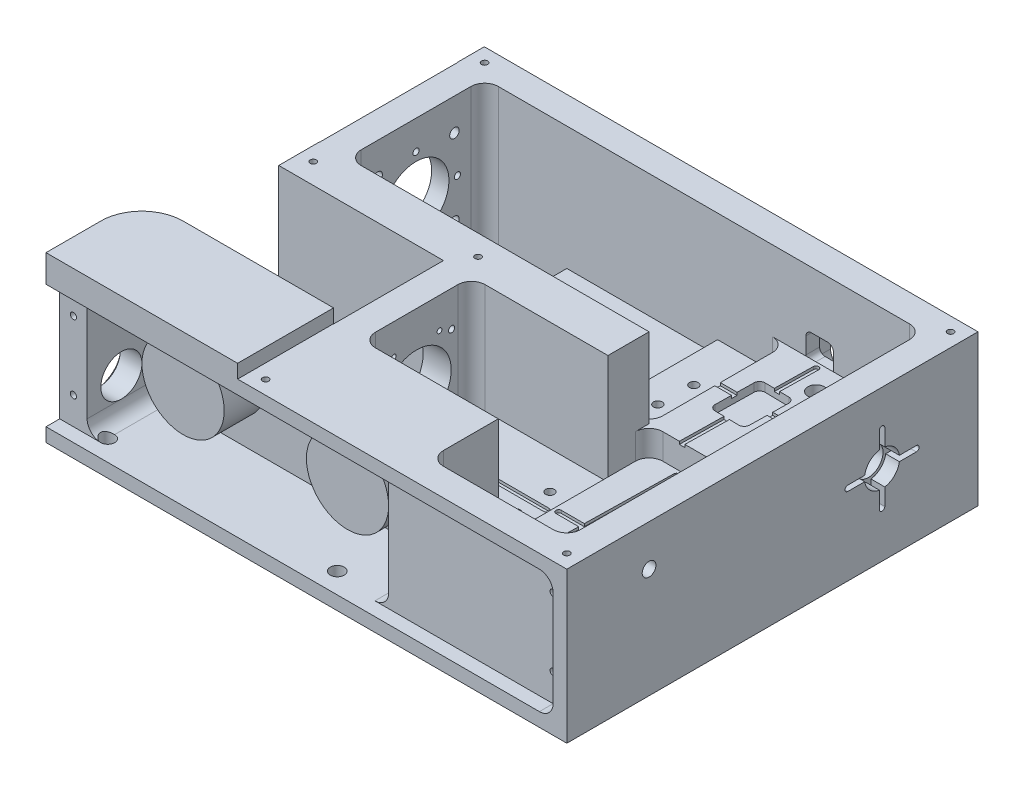
from build123d import *

# Parameters (mm, degrees)
SKETCH7_W                                  = 190
SKETCH7_H                                  = 150
BOSS_EXTRUDE2_DEPTH                        = 60
DIODE_RECESS_REACH                         = 260.362
SKETCH8_W                                  = 10
SKETCH8_H                                  = 50
SKETCH9_W                                  = 30
SKETCH9_H                                  = 50
COLLIMATION_SPACE_DEPTH                    = 55
WAVEPLATE_W                                = 25
WAVEPLATE_H                                = 50
WAVEPLATE_R                                = 1.6
WAVEPLATE_SEAT_DEPTH                       = 45
WAVEPLATE_4_R                              = 1.6
WAVEPLATE_HOLES_DEPTH                      = 49.8
PBS_PIEZO_MIRROR_CORNER_W                  = 25
PBS_PIEZO_MIRROR_CORNER_H                  = 50
PBS_MOUNT_DEPTH                            = 34.05
EXITWINDOW_W                               = 25
EXITWINDOW_H                               = 50
EXIT_WINDOW_DEPTH                          = 34.05
WAVEPLATES_W                               = 49.778354438
WAVEPLATES_H                               = 40
WAVEPLATES_R                               = 1.6
WAVEPLATE_SEAT_2_DEPTH                     = 45
WAVEPLATES_3_R                             = 1.6
WAVEPLATE_HOLES_2_DEPTH                    = 49.8
FIBERPORT_REACH                            = 260.362
FIBERDOCK_W                                = 70
FIBERDOCK_H                                = 40
DIODE_THRU_HOLES_REACH                     = 212.614
SKETCH20_R                                 = 9.9
FIBERPORT_MOUNTING_HOLE_REACH              = 164.352
FIBERPORT_HOLE_R                           = 12.6
EXIT_WINDOW_THRU_HOLE_REACH                = 212.614
SKETCH24_R                                 = 5.35
FILLET7_R                                  = 5
FILLET8_R                                  = 5
PBS_SEAT_DEPTH                             = 37.05
PBS_PIEZO_MIRROR_CORNER_9_W                = 50
PBS_PIEZO_MIRROR_CORNER_9_H                = 80
MIRROR_MOUNT_DEPTH                         = 43.4
FILLET11_R                                 = 2
FILLET12_R                                 = 5
TELESCOPE_W                                = 25
TELESCOPE_H                                = 50
TELESCOPE_INSERT_DEPTH                     = 50
EXIT_START                                 = -5
EXIT_WINDOW_SEAT_DEPTH                     = 5
CUT_EXTRUDE59_REACH                        = 212.614
CUT_EXTRUDE60_DEPTH                        = 211.613972108
CUT_EXTRUDE60_DEPTH_BACK                   = 3.7
SKETCH20_6_R                               = 22.5
APERTURE_W                                 = 30
APERTURE_H                                 = 50
APERTURE_W_2                               = 15
CUT_EXTRUDE61_DEPTH                        = 50
NORMAL_8_SCREW_SLOT_REACH                  = 260.362
F_8_HEX_NUT_RECESS_DEPTH                   = 10
FIBER_BED_DEPTH                            = 30
SKETCH28_10_R                              = 15
FIBER_SPOOLS_DEPTH                         = 15
FILLET16_R                                 = 5
ALIGNMENT_GROOVE1_DEPTH                    = 1
ALIGNMENT_GROOVE2_DEPTH                    = 1
ALIGNMENT_GROOVE3_DEPTH                    = 1
ALIGNMENT_GROOVE5_DEPTH                    = 1
PHOTODIODE_WINDOW_DEPTH                    = 10
PHOTODIODE_RECESS_DEPTH                    = 5
PIEZO_WIRE_EXIT_HOLE_REACH                 = 221.222
SKETCH46_R                                 = 2.5
ALIGNMENT_GROOVE4_DEPTH                    = 1
F_1_4_20_TAPPED_HOLE1_D                    = 5.1054
F_1_4_20_TAPPED_HOLE1_DEPTH                = 9.5
F_1_4_20_TAPPED_HOLE1_TIP                  = 1.533816902
SKETCH47_W                                 = 54
SKETCH47_H                                 = 51
TEC_GROOVES_DEPTH                          = 1
FILLET17_R                                 = 2
FILLET18_R                                 = 15
SKETCH50_W                                 = 185
SKETCH50_H                                 = 45
CUT_EXTRUDE72_DEPTH                        = 5
FILLET19_R                                 = 5
F_4_40_TAPPED_HOLE1_D                      = 2.2606
F_4_40_TAPPED_HOLE1_DEPTH                  = 7.6
F_4_40_TAPPED_HOLE1_TIP                    = 0.679152758
F_6_32_TAPPED_HOLE1_D                      = 2.7051
F_6_32_TAPPED_HOLE3_D                      = 2.7051
SKETCH64_R                                 = 3
CUT_EXTRUDE73_DEPTH                        = 7
CUT_EXTRUDE74_DEPTH                        = 5
F_4_40_TAPPED_HOLE2_D                      = 2.2606
F_4_40_TAPPED_HOLE2_DEPTH                  = 7.6
F_4_40_TAPPED_HOLE2_TIP                    = 0.679152758
CUT_EXTRUDE75_REACH                        = 260.362
SKETCH76_W                                 = 9.9
SKETCH76_H                                 = 10
SKETCH76_H_2                               = 15
SKETCH77_R                                 = 4
SKETCH77_R_2                               = 1.5
CUT_EXTRUDE76_DEPTH                        = 5
F_8_32_TAPPED_HOLE1_REACH                  = 212.614
F_8_32_TAPPED_HOLE1_BORE_R                 = 1.7272
F_2_56_START                               = 114.078066781
F_2_56_TAPPED_HOLE1_OUTLINE_R              = 0.889
F_2_56_TAPPED_HOLE1_DEPTH                  = 10.221645562
F_4_40_TAPPED_HOLE4_REACH                  = 209.461
F_4_40_TAPPED_HOLE4_BORE_R                 = 1.1303
F_6_32_TAPPED_HOLE4_D                      = 2.7051
CSK_FIBERBED_THRU_HOLE_D                   = 14.999999972
CSK_FIBERBED_THRU_HOLE_DEPTH               = 10
CSK_FIBERBED_THRU_HOLE_CSINK_D             = 19.999999878
CSK_FIBERBED_THRU_HOLE_CSINK_ANGLE         = 100
SUK_ADAPTER_FLANGE_2_56_TAPPED_HOLES_D     = 2.2606
SUK_ADAPTER_FLANGE_2_56_TAPPED_HOLES_DEPTH = 10.221645562


# Read off the part's stored shape, not the designer's step: #2-56 Tapped Hole1
with BuildPart() as part:
    # Sketch7 → Boss-Extrude2 (new body)
    with BuildSketch(Plane(origin=(0, 0, 0), x_dir=(1, 0, 0), z_dir=(0, 1, 0))):
        with Locations((139.078066781, -16.423439265)):
            Rectangle(SKETCH7_W, SKETCH7_H)
    extrude(amount=BOSS_EXTRUDE2_DEPTH)

    # Sketch8 → diode_recess (cut, up to next)
    with BuildSketch(Plane(origin=(0, 60, 0), x_dir=(1, 0, 0), z_dir=(0, 1, 0)), mode=Mode.PRIVATE) as diode_recess_sk1:
        with Locations((49.078066781, 23.576560735)):
            Rectangle(SKETCH8_W, SKETCH8_H)
    diode_recess_tool1 = extrude(diode_recess_sk1.sketch, amount=-DIODE_RECESS_REACH, mode=Mode.PRIVATE) & part.part
    add(diode_recess_tool1.solids().sort_by_distance((49.078067, 60, -23.576561))[0], mode=Mode.SUBTRACT)

    # Sketch9 → collimation space (cut)
    with BuildSketch(Plane(origin=(0, 60, 0), x_dir=(1, 0, 0), z_dir=(0, 1, 0))):
        with Locations((79.078066781, 23.576560735)):
            Rectangle(SKETCH9_W, SKETCH9_H)
    extrude(amount=-COLLIMATION_SPACE_DEPTH, mode=Mode.SUBTRACT)

    # waveplate → waveplate seat (cut)
    with BuildSketch(Plane(origin=(0, 60, 0), x_dir=(1, 0, 0), z_dir=(0, 1, 0))):
        with Locations((161.578066781, 23.576560735)):
            Rectangle(WAVEPLATE_W, WAVEPLATE_H)
        with Locations(Location((159.078066781, 29.922692486, 0), (0, 0, 270))):
            Circle(WAVEPLATE_R, mode=Mode.SUBTRACT)
        with Locations(Location((158.634843173, 17.230428983, 0), (0, 0, 270))):
            Circle(WAVEPLATE_R, mode=Mode.SUBTRACT)
    extrude(amount=-WAVEPLATE_SEAT_DEPTH, mode=Mode.SUBTRACT)

    # waveplate<4> → waveplate holes (cut)
    with BuildSketch(Plane(origin=(0, 60, 0), x_dir=(1, 0, 0), z_dir=(0, 1, 0))):
        with Locations(Location((159.078066781, 29.922692486, 0), (0, 0, 270))):
            Circle(WAVEPLATE_4_R)
        with Locations(Location((158.634843173, 17.230428983, 0), (0, 0, 270))):
            Circle(WAVEPLATE_4_R)
    extrude(amount=-WAVEPLATE_HOLES_DEPTH, mode=Mode.SUBTRACT)

    # PBS + piezo mirror corner → PBS mount (cut)
    with BuildSketch(Plane(origin=(0, 60, 0), x_dir=(1, 0, 0), z_dir=(0, 1, 0))):
        with Locations((186.578066781, 23.576560735)):
            Rectangle(PBS_PIEZO_MIRROR_CORNER_W, PBS_PIEZO_MIRROR_CORNER_H)
    extrude(amount=-PBS_MOUNT_DEPTH, mode=Mode.SUBTRACT)

    # exitwindow → exit_window (cut)
    with BuildSketch(Plane(origin=(0, 60, 0), x_dir=(1, 0, 0), z_dir=(0, 1, 0))):
        with Locations((211.578066781, 23.576560735)):
            Rectangle(EXITWINDOW_W, EXITWINDOW_H)
    extrude(amount=-EXIT_WINDOW_DEPTH, mode=Mode.SUBTRACT)

    # waveplates → waveplate seat 2 (cut)
    with BuildSketch(Plane(origin=(0, 60, 0), x_dir=(1, 0, 0), z_dir=(0, 1, 0))):
        with Locations((149.188889562, -36.423439265)):
            Rectangle(WAVEPLATES_W, WAVEPLATES_H)
        with Locations(Location((166.578066781, -30.074406401, 0), (0, 0, 270))):
            Circle(WAVEPLATES_R, mode=Mode.SUBTRACT)
        with Locations(Location((166.799712343, -42.77247213, 0), (0, 0, 270))):
            Circle(WAVEPLATES_R, mode=Mode.SUBTRACT)
        with Locations(Location((141.799712343, -30.074406401, 0), (0, 0, 270))):
            Circle(WAVEPLATES_R, mode=Mode.SUBTRACT)
        with Locations(Location((141.578066781, -42.77247213, 0), (0, 0, 270))):
            Circle(WAVEPLATES_R, mode=Mode.SUBTRACT)
    extrude(amount=-WAVEPLATE_SEAT_2_DEPTH, mode=Mode.SUBTRACT)

    # waveplates<3> → waveplate holes 2 (cut)
    with BuildSketch(Plane(origin=(0, 60, 0), x_dir=(1, 0, 0), z_dir=(0, 1, 0))):
        with Locations(Location((166.578066781, -30.074406401, 0), (0, 0, 270))):
            Circle(WAVEPLATES_3_R)
        with Locations(Location((166.799712343, -42.77247213, 0), (0, 0, 270))):
            Circle(WAVEPLATES_3_R)
        with Locations(Location((141.799712343, -30.074406401, 0), (0, 0, 270))):
            Circle(WAVEPLATES_3_R)
        with Locations(Location((141.578066781, -42.77247213, 0), (0, 0, 270))):
            Circle(WAVEPLATES_3_R)
    extrude(amount=-WAVEPLATE_HOLES_2_DEPTH, mode=Mode.SUBTRACT)

    # fiberdock → fiberport (cut, up to next)
    with BuildSketch(Plane(origin=(0, 60, 0), x_dir=(1, 0, 0), z_dir=(0, 1, 0)), mode=Mode.PRIVATE) as fiberport_sk1:
        with Locations((79.078066781, -36.423439265)):
            Rectangle(FIBERDOCK_W, FIBERDOCK_H)
    fiberport_tool1 = extrude(fiberport_sk1.sketch, amount=-FIBERPORT_REACH, mode=Mode.PRIVATE) & part.part
    add(fiberport_tool1.solids().sort_by_distance((79.078067, 60, 36.423439))[0], mode=Mode.SUBTRACT)

    # Sketch20 → diode thru holes (cut, up to next)
    with BuildSketch(Plane.ZY.offset(-54.078066781), mode=Mode.PRIVATE) as diode_thru_holes_sk1:
        with Locations((-23.576560735, 29.3)):
            Circle(SKETCH20_R)
    diode_thru_holes_tool1 = extrude(diode_thru_holes_sk1.sketch, amount=-DIODE_THRU_HOLES_REACH, mode=Mode.PRIVATE) & part.part
    add(diode_thru_holes_tool1.solids().sort_by_distance((54.078067, 29.3, -23.576561))[0], mode=Mode.SUBTRACT)

    # fiberport hole → fiberport mounting hole (cut, up to next)
    with BuildSketch(Plane.ZY.offset(-114.078066781), mode=Mode.PRIVATE) as fiberport_mounting_hole_sk1:
        with Locations((36.423439265, 29.3)):
            Circle(FIBERPORT_HOLE_R)
    fiberport_mounting_hole_tool1 = extrude(fiberport_mounting_hole_sk1.sketch, amount=-FIBERPORT_MOUNTING_HOLE_REACH, mode=Mode.PRIVATE) & part.part
    add(fiberport_mounting_hole_tool1.solids().sort_by_distance((114.078067, 29.3, 36.423439))[0], mode=Mode.SUBTRACT)

    # Sketch24 → exit window thru hole (cut, up to next)
    with BuildSketch(Plane.ZY.offset(-224.078066781), mode=Mode.PRIVATE) as exit_window_thru_hole_sk1:
        with Locations((-23.576560735, 29.3)):
            Circle(SKETCH24_R)
    exit_window_thru_hole_tool1 = extrude(exit_window_thru_hole_sk1.sketch, amount=-EXIT_WINDOW_THRU_HOLE_REACH, mode=Mode.PRIVATE) & part.part
    add(exit_window_thru_hole_tool1.solids().sort_by_distance((224.078067, 29.3, -23.576561))[0], mode=Mode.SUBTRACT)

    # Fillet7
    fillet7_edges = [part.edges().sort_by_distance(p)[0] for p in [
        (64.078066781, 32.5, 1.423439265),
        (64.078066781, 32.5, -48.576560735),
        (174.078066781, 20.475, 1.423439265),
        (174.078066781, 20.475, -48.576560735),
        (224.078066781, 42.975, -48.576560735),
    ]]
    fillet(fillet7_edges, radius=FILLET7_R)

    # Fillet8
    fillet8_edges = [part.edges().sort_by_distance(p)[0] for p in [
        (124.299712343, 37.5, 16.423439265),
        (124.299712343, 37.5, 56.423439265),
    ]]
    fillet(fillet8_edges, radius=FILLET8_R)

    # PBS + piezo mirror corner<7> → PBS seat (cut)
    with BuildSketch(Plane(origin=(0, 60, 0), x_dir=(1, 0, 0), z_dir=(0, 1, 0))):
        Polygon((180.021969874, 14.689626879), (180.33611319, 32.686885392), (193.134163688, 32.46349459), (192.820020372, 14.466236077), align=None)
    extrude(amount=-PBS_SEAT_DEPTH, mode=Mode.SUBTRACT)

    # PBS + piezo mirror corner<9> → mirror mount (cut)
    with BuildSketch(Plane(origin=(0, 60, 0), x_dir=(1, 0, 0), z_dir=(0, 1, 0))):
        with Locations((199.078066781, -41.423439265)):
            Rectangle(PBS_PIEZO_MIRROR_CORNER_9_W, PBS_PIEZO_MIRROR_CORNER_9_H)
    extrude(amount=-MIRROR_MOUNT_DEPTH, mode=Mode.SUBTRACT)

    # Fillet11
    fillet11_edges = [part.edges().sort_by_distance(p)[0] for p in [
        (180.33611319, 24.45, -32.686885392),
        (193.134163688, 24.45, -32.46349459),
        (192.820020372, 24.45, -14.466236077),
        (180.021969874, 24.45, -14.689626879),
    ]]
    fillet(fillet11_edges, radius=FILLET11_R)

    # Fillet12
    fillet12_edges = [part.edges().sort_by_distance(p)[0] for p in [
        (174.078066781, 21.275, 1.423439265),
        (224.078066781, 21.275, 1.423439265),
        (224.078066781, 38.3, 81.423439265),
        (174.078066781, 38.3, 81.423439265),
    ]]
    fillet(fillet12_edges, radius=FILLET12_R)

    # telescope → telescope_insert (cut)
    with BuildSketch(Plane(origin=(0, 60, 0), x_dir=(1, 0, 0), z_dir=(0, 1, 0))):
        with Locations((106.578066781, 23.576560735)):
            Rectangle(TELESCOPE_W, TELESCOPE_H)
    extrude(amount=-TELESCOPE_INSERT_DEPTH, mode=Mode.SUBTRACT)

    # Sketch29 → exit window seat (cut)
    with BuildSketch(Plane(origin=(234.078066781, 0, 0), x_dir=(0, 0, -1), z_dir=(1, 0, 0)).offset(EXIT_START)):
        with BuildLine():
            ThreePointArc((22.576560735, 35.621392252), (19.051077335, 33.8254834), (17.255168483, 30.3))
            Line((17.255168483, 30.3), (18.320849555, 30.3))
            ThreePointArc((18.320849555, 30.3), (19.793539455, 33.083021279), (22.576560735, 34.555711179))
            Line((22.576560735, 34.555711179), (22.576560735, 35.621392252))
        make_face()
        with BuildLine():
            Line((18.320849555, 30.3), (17.255168483, 30.3))
            ThreePointArc((17.255168483, 30.3), (17.176560735, 29.3), (17.255168483, 28.3))
            Line((17.255168483, 28.3), (18.320849555, 28.3))
            ThreePointArc((18.320849555, 28.3), (18.226560735, 29.3), (18.320849555, 30.3))
        make_face()
        with BuildLine():
            ThreePointArc((29.976560735, 29.3), (29.956878533, 29.801542415), (29.897952986, 30.3))
            Line((29.897952986, 30.3), (28.832271914, 30.3))
            ThreePointArc((28.832271914, 30.3), (28.902936369, 29.802217677), (28.926560735, 29.3))
            ThreePointArc((28.926560735, 29.3), (28.902936369, 28.797782323), (28.832271914, 28.3))
            Line((28.832271914, 28.3), (29.897952986, 28.3))
            ThreePointArc((29.897952986, 28.3), (29.956878533, 28.798457585), (29.976560735, 29.3))
        make_face()
        with BuildLine():
            Line((17.255168483, 30.3), (11.076560735, 30.3))
            ThreePointArc((11.076560735, 30.3), (10.076560735, 29.3), (11.076560735, 28.3))
            Line((11.076560735, 28.3), (17.255168483, 28.3))
            ThreePointArc((17.255168483, 28.3), (17.176560735, 29.3), (17.255168483, 30.3))
        make_face()
        with BuildLine():
            Line((18.320849555, 28.3), (17.255168483, 28.3))
            ThreePointArc((17.255168483, 28.3), (19.051077335, 24.7745166), (22.576560735, 22.978607748))
            Line((22.576560735, 22.978607748), (22.576560735, 24.044288821))
            ThreePointArc((22.576560735, 24.044288821), (19.793539455, 25.516978721), (18.320849555, 28.3))
        make_face()
        with BuildLine():
            ThreePointArc((24.576560735, 35.621392252), (23.576560735, 35.7), (22.576560735, 35.621392252))
            Line((22.576560735, 35.621392252), (22.576560735, 34.555711179))
            ThreePointArc((22.576560735, 34.555711179), (23.576560735, 34.65), (24.576560735, 34.555711179))
            Line((24.576560735, 34.555711179), (24.576560735, 35.621392252))
        make_face()
        with BuildLine():
            Line((22.576560735, 24.044288821), (22.576560735, 22.978607748))
            ThreePointArc((22.576560735, 22.978607748), (23.576560735, 22.9), (24.576560735, 22.978607748))
            Line((24.576560735, 22.978607748), (24.576560735, 24.044288821))
            ThreePointArc((24.576560735, 24.044288821), (23.576560735, 23.95), (22.576560735, 24.044288821))
        make_face()
        with BuildLine():
            ThreePointArc((24.576560735, 22.978607748), (23.576560735, 22.9), (22.576560735, 22.978607748))
            Line((22.576560735, 22.978607748), (22.576560735, 16.8))
            ThreePointArc((22.576560735, 16.8), (23.576560735, 15.8), (24.576560735, 16.8))
            Line((24.576560735, 16.8), (24.576560735, 22.978607748))
        make_face()
        with BuildLine():
            Line((22.576560735, 41.8), (22.576560735, 35.621392252))
            ThreePointArc((22.576560735, 35.621392252), (23.576560735, 35.7), (24.576560735, 35.621392252))
            Line((24.576560735, 35.621392252), (24.576560735, 41.8))
            ThreePointArc((24.576560735, 41.8), (23.576560735, 42.8), (22.576560735, 41.8))
        make_face()
        with BuildLine():
            ThreePointArc((29.897952986, 30.3), (28.102044134, 33.8254834), (24.576560735, 35.621392252))
            Line((24.576560735, 35.621392252), (24.576560735, 34.555711179))
            ThreePointArc((24.576560735, 34.555711179), (27.359582014, 33.083021279), (28.832271914, 30.3))
            Line((28.832271914, 30.3), (29.897952986, 30.3))
        make_face()
        with BuildLine():
            Line((24.576560735, 24.044288821), (24.576560735, 22.978607748))
            ThreePointArc((24.576560735, 22.978607748), (28.102044134, 24.7745166), (29.897952986, 28.3))
            Line((29.897952986, 28.3), (28.832271914, 28.3))
            ThreePointArc((28.832271914, 28.3), (27.359582014, 25.516978721), (24.576560735, 24.044288821))
        make_face()
        with BuildLine():
            Line((36.076560735, 30.3), (29.897952986, 30.3))
            ThreePointArc((29.897952986, 30.3), (29.956878533, 29.801542415), (29.976560735, 29.3))
            ThreePointArc((29.976560735, 29.3), (29.956878533, 28.798457585), (29.897952986, 28.3))
            Line((29.897952986, 28.3), (36.076560735, 28.3))
            ThreePointArc((36.076560735, 28.3), (37.076560735, 29.3), (36.076560735, 30.3))
        make_face()
    extrude(amount=EXIT_WINDOW_SEAT_DEPTH, mode=Mode.SUBTRACT)

    # Sketch20<5> → Cut-Extrude59 (cut, up to next)
    with BuildSketch(Plane.ZY.offset(-54.078066781), mode=Mode.PRIVATE) as cut_extrude59_sk1:
        with BuildLine():
            ThreePointArc((-11.576560735, 29.3), (-15.09127936, 37.785281374), (-23.576560735, 41.3))
            Line((-23.576560735, 41.3), (-23.576560735, 39.2))
            ThreePointArc((-23.576560735, 39.2), (-16.576203601, 36.300357134), (-13.676560735, 29.3))
            ThreePointArc((-13.676560735, 29.3), (-16.576203601, 22.299642866), (-23.576560735, 19.4))
            Line((-23.576560735, 19.4), (-23.576560735, 17.3))
            ThreePointArc((-23.576560735, 17.3), (-15.09127936, 20.814718626), (-11.576560735, 29.3))
        make_face()
    cut_extrude59_tool1 = extrude(cut_extrude59_sk1.sketch, amount=-CUT_EXTRUDE59_REACH, mode=Mode.PRIVATE) & part.part
    # Sketch20<5> → Cut-Extrude59 (cut, up to next)
    with BuildSketch(Plane.ZY.offset(-54.078066781), mode=Mode.PRIVATE) as cut_extrude59_sk2:
        with BuildLine():
            Line((-23.576560735, 39.2), (-23.576560735, 41.3))
            ThreePointArc((-23.576560735, 41.3), (-35.576560735, 29.3), (-23.576560735, 17.3))
            Line((-23.576560735, 17.3), (-23.576560735, 19.4))
            ThreePointArc((-23.576560735, 19.4), (-30.576917868, 22.299642866), (-33.476560735, 29.3))
            ThreePointArc((-33.476560735, 29.3), (-30.576917868, 36.300357134), (-23.576560735, 39.2))
        make_face()
    cut_extrude59_tool2 = extrude(cut_extrude59_sk2.sketch, amount=-CUT_EXTRUDE59_REACH, mode=Mode.PRIVATE) & part.part
    # Sketch20<5> → Cut-Extrude59 (cut, up to next)
    with BuildSketch(Plane.ZY.offset(-54.078066781), mode=Mode.PRIVATE) as cut_extrude59_sk3:
        with BuildLine():
            ThreePointArc((-11.576560735, 29.3), (-15.09127936, 37.785281374), (-23.576560735, 41.3))
            Line((-23.576560735, 41.3), (-23.576560735, 39.2))
            ThreePointArc((-23.576560735, 39.2), (-16.576203601, 36.300357134), (-13.676560735, 29.3))
            ThreePointArc((-13.676560735, 29.3), (-16.576203601, 22.299642866), (-23.576560735, 19.4))
            Line((-23.576560735, 19.4), (-23.576560735, 17.3))
            ThreePointArc((-23.576560735, 17.3), (-15.09127936, 20.814718626), (-11.576560735, 29.3))
        make_face()
    cut_extrude59_tool3 = extrude(cut_extrude59_sk3.sketch, amount=-CUT_EXTRUDE59_REACH, mode=Mode.PRIVATE) & part.part
    # Sketch20<5> → Cut-Extrude59 (cut, up to next)
    with BuildSketch(Plane.ZY.offset(-54.078066781), mode=Mode.PRIVATE) as cut_extrude59_sk4:
        with BuildLine():
            Line((-23.576560735, 39.2), (-23.576560735, 41.3))
            ThreePointArc((-23.576560735, 41.3), (-35.576560735, 29.3), (-23.576560735, 17.3))
            Line((-23.576560735, 17.3), (-23.576560735, 19.4))
            ThreePointArc((-23.576560735, 19.4), (-30.576917868, 22.299642866), (-33.476560735, 29.3))
            ThreePointArc((-33.476560735, 29.3), (-30.576917868, 36.300357134), (-23.576560735, 39.2))
        make_face()
    cut_extrude59_tool4 = extrude(cut_extrude59_sk4.sketch, amount=-CUT_EXTRUDE59_REACH, mode=Mode.PRIVATE) & part.part
    add(cut_extrude59_tool1.solids().sort_by_distance((54.078067, 21.004455, -15.281016))[0], mode=Mode.SUBTRACT)
    add(cut_extrude59_tool2.solids().sort_by_distance((54.078067, 40.25, -23.844889))[0], mode=Mode.SUBTRACT)
    add(cut_extrude59_tool3.solids().sort_by_distance((54.078067, 21.004455, -15.281016))[0], mode=Mode.SUBTRACT)
    add(cut_extrude59_tool4.solids().sort_by_distance((54.078067, 40.25, -23.844889))[0], mode=Mode.SUBTRACT)

    # Sketch20<6> → Cut-Extrude60 (cut, two sides: drawn at the far end of the back side and taken through both)
    with BuildSketch(Plane.ZY.offset(-54.078066781).offset(-CUT_EXTRUDE60_DEPTH_BACK)):
        with Locations((-23.576560735, 29.3)):
            Circle(SKETCH20_6_R)
    extrude(amount=CUT_EXTRUDE60_DEPTH + CUT_EXTRUDE60_DEPTH_BACK, mode=Mode.SUBTRACT)

    # aperture → Cut-Extrude61 (cut)
    with BuildSketch(Plane(origin=(0, 60, 0), x_dir=(1, 0, 0), z_dir=(0, 1, 0))):
        with Locations((134.078066781, 23.576560735)):
            Rectangle(APERTURE_W, APERTURE_H)
        with Locations((126.578066781, 23.576560735)):
            Rectangle(APERTURE_W_2, APERTURE_H)
    extrude(amount=-CUT_EXTRUDE61_DEPTH, mode=Mode.SUBTRACT)

    # PBS + piezo mirror corner<14> → normal #8 screw slot (cut, up to next)
    with BuildSketch(Plane(origin=(0, 60, 0), x_dir=(1, 0, 0), z_dir=(0, 1, 0)), mode=Mode.PRIVATE) as normal_8_screw_slot_sk1:
        with BuildLine():
            Line((198.223652783, -56.892854828), (198.398176847, -46.894377877))
            ThreePointArc((198.398176847, -46.894377877), (200.905821598, -44.47277349), (203.327425985, -46.980418241))
            Line((203.327425985, -46.980418241), (203.15290192, -56.978895192))
            ThreePointArc((203.15290192, -56.978895192), (200.64525717, -59.400499579), (198.223652783, -56.892854828))
        make_face()
    normal_8_screw_slot_tool1 = extrude(normal_8_screw_slot_sk1.sketch, amount=-NORMAL_8_SCREW_SLOT_REACH, mode=Mode.PRIVATE) & part.part
    add(normal_8_screw_slot_tool1.solids().sort_by_distance((200.775539, 60, 51.936637))[0], mode=Mode.SUBTRACT)

    # Sketch34 → #8 hex nut recess (cut)
    with BuildSketch(Plane.XZ):
        with BuildLine():
            Line((206.188190595, 56.988843064), (206.358636619, 47.22399689))
            ThreePointArc((206.358636619, 47.22399689), (200.955462531, 41.628846332), (195.360311972, 47.03202042))
            Line((195.360311972, 47.03202042), (195.189865948, 56.796866593))
            ThreePointArc((195.189865948, 56.796866593), (200.593040036, 62.392017152), (206.188190595, 56.988843064))
        make_face()
    extrude(amount=-F_8_HEX_NUT_RECESS_DEPTH, mode=Mode.SUBTRACT)

    # Sketch28 → fiber bed (cut)
    with BuildSketch(Plane.XY.offset(91.423439265)):
        with BuildLine():
            Line((94.078066781, 27.5), (109.078066781, 27.5))
            Line((109.078066781, 27.5), (109.078066781, 50))
            Line((109.078066781, 50), (54.078066781, 50))
            Line((54.078066781, 50), (54.078066781, 27.5))
            Line((54.078066781, 27.5), (64.078066781, 27.5))
            ThreePointArc((64.078066781, 27.5), (79.078066781, 42.5), (94.078066781, 27.5))
        make_face()
        with BuildLine():
            Line((109.078066781, 5), (109.078066781, 27.5))
            Line((109.078066781, 27.5), (94.078066781, 27.5))
            ThreePointArc((94.078066781, 27.5), (79.078066781, 12.5), (64.078066781, 27.5))
            Line((64.078066781, 27.5), (54.078066781, 27.5))
            Line((54.078066781, 27.5), (54.078066781, 5))
            Line((54.078066781, 5), (109.078066781, 5))
        make_face()
        with BuildLine():
            ThreePointArc((124.078066781, 27.5), (139.078066781, 42.5), (154.078066781, 27.5))
            Line((154.078066781, 27.5), (164.078066781, 27.5))
            Line((164.078066781, 27.5), (164.078066781, 50))
            Line((164.078066781, 50), (109.078066781, 50))
            Line((109.078066781, 50), (109.078066781, 27.5))
            Line((109.078066781, 27.5), (124.078066781, 27.5))
        make_face()
        with BuildLine():
            Line((164.078066781, 27.5), (154.078066781, 27.5))
            ThreePointArc((154.078066781, 27.5), (139.078066781, 12.5), (124.078066781, 27.5))
            Line((124.078066781, 27.5), (109.078066781, 27.5))
            Line((109.078066781, 27.5), (109.078066781, 5))
            Line((109.078066781, 5), (164.078066781, 5))
            Line((164.078066781, 5), (164.078066781, 27.5))
        make_face()
    extrude(amount=-FIBER_BED_DEPTH, mode=Mode.SUBTRACT)

    # Sketch28<10> → fiber spools (cut)
    with BuildSketch(Plane.XY.offset(91.423439265)):
        with BuildLine():
            ThreePointArc((64.078066781, 27.5), (79.078066781, 12.5), (94.078066781, 27.5))
            Line((94.078066781, 27.5), (64.078066781, 27.5))
        make_face()
        with BuildLine():
            Line((64.078066781, 27.5), (94.078066781, 27.5))
            ThreePointArc((94.078066781, 27.5), (79.078066781, 42.5), (64.078066781, 27.5))
        make_face()
        with Locations((139.078066781, 27.5)):
            Circle(SKETCH28_10_R)
    extrude(amount=-FIBER_SPOOLS_DEPTH, mode=Mode.SUBTRACT)

    # Fillet16
    fillet16_edges = [part.edges().sort_by_distance(p)[0] for p in [
        (164.078066781, 50, 76.423439265),
        (54.078066781, 50, 76.423439265),
        (54.078066781, 5, 76.423439265),
        (164.078066781, 5, 76.423439265),
    ]]
    fillet(fillet16_edges, radius=FILLET16_R)

    # Sketch36 → alignment_groove1 (cut)
    with BuildSketch(Plane(origin=(0, 15, 0), x_dir=(1, 0, 0), z_dir=(0, 1, 0))):
        with BuildLine():
            Line((172.587278142, -36.423439265), (125.299712343, -36.423439265))
            ThreePointArc((125.299712343, -36.423439265), (125.592605562, -37.130546047), (126.299712343, -37.423439265))
            Line((126.299712343, -37.423439265), (171.587278142, -37.423439265))
            ThreePointArc((171.587278142, -37.423439265), (172.294384923, -37.130546047), (172.587278142, -36.423439265))
        make_face()
        with BuildLine():
            ThreePointArc((126.299712343, -35.423439265), (125.592605562, -35.716332484), (125.299712343, -36.423439265))
            Line((125.299712343, -36.423439265), (172.587278142, -36.423439265))
            ThreePointArc((172.587278142, -36.423439265), (172.294384923, -35.716332484), (171.587278142, -35.423439265))
            Line((171.587278142, -35.423439265), (126.299712343, -35.423439265))
        make_face()
    extrude(amount=-ALIGNMENT_GROOVE1_DEPTH, mode=Mode.SUBTRACT)

    # Sketch37 → alignment_groove2 (cut)
    with BuildSketch(Plane(origin=(0, 10, 0), x_dir=(1, 0, 0), z_dir=(0, 1, 0))):
        with BuildLine():
            Line((96.078066781, 24.576560735), (147.078066781, 24.576560735))
            ThreePointArc((147.078066781, 24.576560735), (148.078066781, 23.576560735), (147.078066781, 22.576560735))
            Line((147.078066781, 22.576560735), (96.078066781, 22.576560735))
            ThreePointArc((96.078066781, 22.576560735), (95.078066781, 23.576560735), (96.078066781, 24.576560735))
        make_face()
    extrude(amount=-ALIGNMENT_GROOVE2_DEPTH, mode=Mode.SUBTRACT)

    # Sketch39 → alignment_groove3 (cut)
    with BuildSketch(Plane(origin=(0, 25.95, 0), x_dir=(1, 0, 0), z_dir=(0, 1, 0))):
        Polygon((174.078066781, 24.576560735), (174.078066781, 22.576560735), (180.159636817, 22.576560735), (180.194546946, 24.576560735), align=None)
        Polygon((185.420995123, 14.595386543), (185.141385478, -1.423439265), (187.141994837, -1.423439265), (187.420995123, 14.560476413), align=None)
        with BuildLine():
            Line((185.979685579, 46.594013141), (185.735290744, 32.592642397))
            Line((185.735290744, 32.592642397), (187.734986134, 32.557737585))
            Line((187.734986134, 32.557737585), (187.979380969, 46.559108328))
            ThreePointArc((187.979380969, 46.559108328), (186.996985681, 47.57640843), (185.979685579, 46.594013141))
        make_face()
    extrude(amount=-ALIGNMENT_GROOVE3_DEPTH, mode=Mode.SUBTRACT)

    # Sketch41 → alignment_groove5 (cut)
    with BuildSketch(Plane(origin=(0, 16.6, 0), x_dir=(1, 0, 0), z_dir=(0, 1, 0))):
        with BuildLine():
            Line((176.078066781, -35.423439265), (222.078066781, -35.423439265))
            ThreePointArc((222.078066781, -35.423439265), (223.078066781, -36.423439265), (222.078066781, -37.423439265))
            Line((222.078066781, -37.423439265), (176.078066781, -37.423439265))
            ThreePointArc((176.078066781, -37.423439265), (175.078066781, -36.423439265), (176.078066781, -35.423439265))
        make_face()
        with BuildLine():
            Line((187.073811661, -3.442711869), (185.608821705, -79.442711869))
            ThreePointArc((185.608821705, -79.442711869), (184.589734836, -80.423253532), (183.609193173, -79.404166662))
            Line((183.609193173, -79.404166662), (185.074183129, -3.404166662))
            ThreePointArc((185.074183129, -3.404166662), (186.093269998, -2.423624999), (187.073811661, -3.442711869))
        make_face()
    extrude(amount=-ALIGNMENT_GROOVE5_DEPTH, mode=Mode.SUBTRACT)

    # Sketch44 → photodiode window (cut)
    with BuildSketch(Plane(origin=(0, 0, -58.576560735), x_dir=(-1, 0, 0), z_dir=(0, 0, -1))):
        with BuildLine():
            Line((-189.300527141, 24.3), (-183.300527141, 24.3))
            ThreePointArc((-183.300527141, 24.3), (-181.886313579, 24.885786438), (-181.300527141, 26.3))
            Line((-181.300527141, 26.3), (-181.300527141, 32.3))
            ThreePointArc((-181.300527141, 32.3), (-181.886313579, 33.714213562), (-183.300527141, 34.3))
            Line((-183.300527141, 34.3), (-189.300527141, 34.3))
            ThreePointArc((-189.300527141, 34.3), (-190.714740704, 33.714213562), (-191.300527141, 32.3))
            Line((-191.300527141, 32.3), (-191.300527141, 26.3))
            ThreePointArc((-191.300527141, 26.3), (-190.714740704, 24.885786438), (-189.300527141, 24.3))
        make_face()
    extrude(amount=-PHOTODIODE_WINDOW_DEPTH, mode=Mode.SUBTRACT)

    # Sketch44<3> → photodiode recess (cut)
    with BuildSketch(Plane(origin=(0, 0, -58.576560735), x_dir=(-1, 0, 0), z_dir=(0, 0, -1))):
        with BuildLine():
            Line((-187.300527141, 17.7), (-185.300527141, 17.7))
            ThreePointArc((-185.300527141, 17.7), (-181.764993236, 19.164466094), (-180.300527141, 22.7))
            Line((-180.300527141, 22.7), (-180.300527141, 35.9))
            ThreePointArc((-180.300527141, 35.9), (-181.764993236, 39.435533906), (-185.300527141, 40.9))
            Line((-185.300527141, 40.9), (-187.300527141, 40.9))
            ThreePointArc((-187.300527141, 40.9), (-190.836061047, 39.435533906), (-192.300527141, 35.9))
            Line((-192.300527141, 35.9), (-192.300527141, 22.7))
            ThreePointArc((-192.300527141, 22.7), (-190.836061047, 19.164466094), (-187.300527141, 17.7))
        make_face()
    extrude(amount=-PHOTODIODE_RECESS_DEPTH, mode=Mode.SUBTRACT)

    # Sketch46 → piezo wire exit hole (cut, up to next)
    with BuildSketch(Plane(origin=(234.078066781, 0, 0), x_dir=(0, 0, -1), z_dir=(1, 0, 0)), mode=Mode.PRIVATE) as piezo_wire_exit_hole_sk1:
        with Locations((-61.423439265, 40)):
            Circle(SKETCH46_R)
    piezo_wire_exit_hole_tool1 = extrude(piezo_wire_exit_hole_sk1.sketch, amount=-PIEZO_WIRE_EXIT_HOLE_REACH, mode=Mode.PRIVATE) & part.part
    add(piezo_wire_exit_hole_tool1.solids().sort_by_distance((234.078067, 40, 61.423439))[0], mode=Mode.SUBTRACT)

    # Sketch40 → alignment_groove4 (cut)
    with BuildSketch(Plane(origin=(0, 25.95, 0), x_dir=(1, 0, 0), z_dir=(0, 1, 0))):
        with BuildLine():
            ThreePointArc((201.078066781, 22.749202075), (200.078066781, 23.749202075), (201.078066781, 24.749202075))
            Line((201.078066781, 24.749202075), (192.999510211, 24.749202075))
            Line((192.999510211, 24.749202075), (192.964600081, 22.749202075))
            Line((192.964600081, 22.749202075), (201.078066781, 22.749202075))
        make_face()
        with BuildLine():
            Line((222.078066781, 24.749202075), (201.078066781, 24.749202075))
            ThreePointArc((201.078066781, 24.749202075), (200.078066781, 23.749202075), (201.078066781, 22.749202075))
            Line((201.078066781, 22.749202075), (222.078066781, 22.749202075))
            ThreePointArc((222.078066781, 22.749202075), (223.078066781, 23.749202075), (222.078066781, 24.749202075))
        make_face()
    extrude(amount=-ALIGNMENT_GROOVE4_DEPTH, mode=Mode.SUBTRACT)

    # 1/4-20 Tapped Hole1
    with Locations(Plane(origin=(0, 0, 0), x_dir=(-1, 0, 0), z_dir=(0, -1, 0))):
        with Locations((-59.078066781, -83.923439265), (-142.828066781, -83.923439265), (-226.578066781, -83.923439265), (-226.578066781, 51.076560735), (-142.828066781, 51.076560735), (-59.078066781, 51.076560735)):
            Hole(F_1_4_20_TAPPED_HOLE1_D / 2, depth=F_1_4_20_TAPPED_HOLE1_DEPTH)
            with Locations((0, 0, -(F_1_4_20_TAPPED_HOLE1_DEPTH + F_1_4_20_TAPPED_HOLE1_TIP / 2))):  # 118° drill point
                Cone(0, F_1_4_20_TAPPED_HOLE1_D / 2, F_1_4_20_TAPPED_HOLE1_TIP, mode=Mode.SUBTRACT)

    # Sketch47 → TEC grooves (cut)
    with BuildSketch(Plane.XZ):
        with Locations((101.078066781, -25.576560735)):
            Rectangle(SKETCH47_W, SKETCH47_H)
        with Locations((169.828066781, 43.423439265)):
            Rectangle(SKETCH47_W, SKETCH47_H)
        with Locations((184.578066781, -25.576560735)):
            Rectangle(SKETCH47_W, SKETCH47_H)
    extrude(amount=-TEC_GROOVES_DEPTH, mode=Mode.SUBTRACT)

    # Fillet17
    fillet17_edges = [part.edges().sort_by_distance(p)[0] for p in [
        (196.828066781, 0.5, 68.923439265),
        (196.828066781, 0.5, 17.923439265),
        (142.828066781, 0.5, 17.923439265),
        (142.828066781, 0.5, 68.923439265),
        (128.078066781, 0.5, -0.076560735),
        (128.078066781, 0.5, -51.076560735),
        (74.078066781, 0.5, -51.076560735),
        (74.078066781, 0.5, -0.076560735),
        (211.578066781, 0.5, -0.076560735),
        (211.578066781, 0.5, -51.076560735),
        (157.578066781, 0.5, -51.076560735),
        (157.578066781, 0.5, -0.076560735),
    ]]
    fillet(fillet17_edges, radius=FILLET17_R)

    # Fillet18
    fillet18_edges = [part.edges().sort_by_distance(p)[0] for p in [
        (44.078066781, 30, 56.423439265),
    ]]
    fillet(fillet18_edges, radius=FILLET18_R)

    # Sketch50 → Cut-Extrude72 (cut)
    with BuildSketch(Plane.XY.offset(91.423439265)):
        with Locations((136.578066781, 27.5)):
            Rectangle(SKETCH50_W, SKETCH50_H)
    extrude(amount=-CUT_EXTRUDE72_DEPTH, mode=Mode.SUBTRACT)

    # Fillet19
    # the kernel refuses this fillet: 5 mm, written as the material it adds along each edge
    with BuildSketch(Plane(origin=(229.078066781, 5, 91.423439265), x_dir=(0, 1, 0), z_dir=(0, 0, -1))) as fillet19_piece_1_section:
        with BuildLine():
            CenterArc((FILLET19_R, -FILLET19_R), FILLET19_R, 90, 90)
            Line((0, -FILLET19_R), (0, 0))
            Line((0, 0), (FILLET19_R, 0))
        make_face()
    fillet19_piece_1 = extrude(amount=17.5, mode=Mode.PRIVATE)
    fillet19_piece_1 = fillet19_piece_1 - Plane(origin=(226.578066781, 6.132713607, 83.923439265), x_dir=(1, 0, 0), z_dir=(0, 1, 0)) * Cylinder(2.5527, 55, mode=Mode.PRIVATE)
    add(fillet19_piece_1)
    with BuildSketch(Plane(origin=(229.078066781, 50, 91.423439265), x_dir=(-1, 0, 0), z_dir=(0, 0, -1))) as fillet19_piece_2:
        with BuildLine():
            CenterArc((FILLET19_R, -FILLET19_R), FILLET19_R, 90, 90)
            Line((0, -FILLET19_R), (0, 0))
            Line((0, 0), (FILLET19_R, 0))
        make_face()
    extrude(amount=17.5)

    # #4-40 Tapped Hole1
    with Locations(Plane.XY.offset(86.423439265)):
        with Locations((49.078066781, 40), (49.078066781, 15), (224.078066781, 15), (224.078066781, 40)):
            Hole(F_4_40_TAPPED_HOLE1_D / 2, depth=F_4_40_TAPPED_HOLE1_DEPTH)
            with Locations((0, 0, -(F_4_40_TAPPED_HOLE1_DEPTH + F_4_40_TAPPED_HOLE1_TIP / 2))):  # 118° drill point
                Cone(0, F_4_40_TAPPED_HOLE1_D / 2, F_4_40_TAPPED_HOLE1_TIP, mode=Mode.SUBTRACT)

    # #6-32 Tapped Hole1 (through all)
    with Locations(Plane(origin=(0, 10, 0), x_dir=(1, 0, 0), z_dir=(0, 1, 0))):
        with Locations((99.078066781, 35.576560735), (114.078066781, 35.576560735), (114.078066781, 11.576560735), (99.078066781, 11.576560735)):
            Hole(F_6_32_TAPPED_HOLE1_D / 2)

    # #6-32 Tapped Hole3 (through all)
    with Locations(Plane(origin=(0, 25.95, 0), x_dir=(1, 0, 0), z_dir=(0, 1, 0))):
        with Locations((194.363848047, 39.249199634)):
            Hole(F_6_32_TAPPED_HOLE3_D / 2)

    # Sketch64 → Cut-Extrude73 (cut)
    with BuildSketch(Plane(origin=(0, 25.95, 0), x_dir=(1, 0, 0), z_dir=(0, 1, 0))):
        with Locations(Location((194.363848047, 39.249199634, 0), (0, 0, 270))):
            Circle(SKETCH64_R)
    extrude(amount=-CUT_EXTRUDE73_DEPTH, mode=Mode.SUBTRACT)

    # Sketch71 → Cut-Extrude74 (cut)
    with BuildSketch(Plane(origin=(0, 60, 0), x_dir=(1, 0, 0), z_dir=(0, 1, 0))):
        with BuildLine():
            Line((234.078066781, 58.576560735), (53.978066781, 58.576560735))
            Line((53.978066781, 58.576560735), (53.978066781, -16.423439265))
            Line((53.978066781, -16.423439265), (108.878066781, -16.423439265))
            ThreePointArc((108.878066781, -16.423439265), (112.484311365, -17.917194681), (113.978066781, -21.523439265))
            Line((113.978066781, -21.523439265), (113.978066781, -91.423439265))
            Line((113.978066781, -91.423439265), (234.078066781, -91.423439265))
            Line((234.078066781, -91.423439265), (234.078066781, -16.423439265))
            Line((234.078066781, -16.423439265), (234.078066781, 58.576560735))
        make_face()
    extrude(amount=-CUT_EXTRUDE74_DEPTH, mode=Mode.SUBTRACT)

    # #4-40 Tapped Hole2
    with Locations(Plane(origin=(0, 55, 0), x_dir=(1, 0, 0), z_dir=(0, 1, 0))):
        with Locations((59.078066781, 53.576560735), (229.078066781, 53.576560735), (229.078066781, -86.423439265), (119.188889562, -86.423439265), (119.188889562, -8.923439265), (59.078066781, -8.923439265)):
            Hole(F_4_40_TAPPED_HOLE2_D / 2, depth=F_4_40_TAPPED_HOLE2_DEPTH)
            with Locations((0, 0, -(F_4_40_TAPPED_HOLE2_DEPTH + F_4_40_TAPPED_HOLE2_TIP / 2))):  # 118° drill point
                Cone(0, F_4_40_TAPPED_HOLE2_D / 2, F_4_40_TAPPED_HOLE2_TIP, mode=Mode.SUBTRACT)

    # Sketch76 → Cut-Extrude75 (cut, up to next)
    with BuildSketch(Plane(origin=(0, 60, 0), x_dir=(1, 0, 0), z_dir=(0, 1, 0)), mode=Mode.PRIVATE) as cut_extrude75_sk1:
        with Locations((49.028066781, 53.576560735)):
            Rectangle(SKETCH76_W, SKETCH76_H)
    cut_extrude75_tool1 = extrude(cut_extrude75_sk1.sketch, amount=-CUT_EXTRUDE75_REACH, mode=Mode.PRIVATE) & part.part
    # Sketch76 → Cut-Extrude75 (cut, up to next)
    with BuildSketch(Plane(origin=(0, 60, 0), x_dir=(1, 0, 0), z_dir=(0, 1, 0)), mode=Mode.PRIVATE) as cut_extrude75_sk2:
        with Locations((49.028066781, -8.923439265)):
            Rectangle(SKETCH76_W, SKETCH76_H_2)
    cut_extrude75_tool2 = extrude(cut_extrude75_sk2.sketch, amount=-CUT_EXTRUDE75_REACH, mode=Mode.PRIVATE) & part.part
    add(cut_extrude75_tool1.solids().sort_by_distance((49.028067, 60, -53.576561))[0], mode=Mode.SUBTRACT)
    add(cut_extrude75_tool2.solids().sort_by_distance((49.028067, 60, 8.923439))[0], mode=Mode.SUBTRACT)

    # Sketch77 → Cut-Extrude76 (cut)
    with BuildSketch(Plane.ZY.offset(-53.978066781)):
        with Locations((8.923439265, 35)):
            Circle(SKETCH77_R)
        with Locations((8.923439265, 15)):
            Circle(SKETCH77_R_2)
    extrude(amount=-CUT_EXTRUDE76_DEPTH, mode=Mode.SUBTRACT)

    # #8-32 Tapped Hole1 bore → #8-32 Tapped Hole1 (cut, up to next)
    with BuildSketch(Plane.ZY.offset(-54.078066781), mode=Mode.PRIVATE) as f_8_32_tapped_hole1_sk1:
        with Locations((-37.576560735, 43.3)):
            Circle(F_8_32_TAPPED_HOLE1_BORE_R)
    f_8_32_tapped_hole1_tool1 = extrude(f_8_32_tapped_hole1_sk1.sketch, amount=-F_8_32_TAPPED_HOLE1_REACH, mode=Mode.PRIVATE) & part.part
    # #8-32 Tapped Hole1 bore → #8-32 Tapped Hole1 (cut, up to next)
    with BuildSketch(Plane.ZY.offset(-54.078066781), mode=Mode.PRIVATE) as f_8_32_tapped_hole1_sk2:
        with Locations((-9.576560735, 43.3)):
            Circle(F_8_32_TAPPED_HOLE1_BORE_R)
    f_8_32_tapped_hole1_tool2 = extrude(f_8_32_tapped_hole1_sk2.sketch, amount=-F_8_32_TAPPED_HOLE1_REACH, mode=Mode.PRIVATE) & part.part
    # #8-32 Tapped Hole1 bore → #8-32 Tapped Hole1 (cut, up to next)
    with BuildSketch(Plane.ZY.offset(-54.078066781), mode=Mode.PRIVATE) as f_8_32_tapped_hole1_sk3:
        with Locations((-9.576560735, 15.3)):
            Circle(F_8_32_TAPPED_HOLE1_BORE_R)
    f_8_32_tapped_hole1_tool3 = extrude(f_8_32_tapped_hole1_sk3.sketch, amount=-F_8_32_TAPPED_HOLE1_REACH, mode=Mode.PRIVATE) & part.part
    # #8-32 Tapped Hole1 bore → #8-32 Tapped Hole1 (cut, up to next)
    with BuildSketch(Plane.ZY.offset(-54.078066781), mode=Mode.PRIVATE) as f_8_32_tapped_hole1_sk4:
        with Locations((-37.576560735, 15.3)):
            Circle(F_8_32_TAPPED_HOLE1_BORE_R)
    f_8_32_tapped_hole1_tool4 = extrude(f_8_32_tapped_hole1_sk4.sketch, amount=-F_8_32_TAPPED_HOLE1_REACH, mode=Mode.PRIVATE) & part.part
    add(f_8_32_tapped_hole1_tool1.solids().sort_by_distance((54.078067, 43.3, -37.576561))[0], mode=Mode.SUBTRACT)
    add(f_8_32_tapped_hole1_tool2.solids().sort_by_distance((54.078067, 43.3, -9.576561))[0], mode=Mode.SUBTRACT)
    add(f_8_32_tapped_hole1_tool3.solids().sort_by_distance((54.078067, 15.3, -9.576561))[0], mode=Mode.SUBTRACT)
    add(f_8_32_tapped_hole1_tool4.solids().sort_by_distance((54.078067, 15.3, -37.576561))[0], mode=Mode.SUBTRACT)

    # #2-56 Tapped Hole1 outline → #2-56 Tapped Hole1 (cut)
    with BuildSketch(Plane.YZ.offset(F_2_56_START)):
        with Locations((14.85, 28.073439265)):
            Circle(F_2_56_TAPPED_HOLE1_OUTLINE_R)
        with Locations((14.85, 44.773439265)):
            Circle(F_2_56_TAPPED_HOLE1_OUTLINE_R)
        with Locations((43.75, 44.773439265)):
            Circle(F_2_56_TAPPED_HOLE1_OUTLINE_R)
        with Locations((43.75, 28.073439265)):
            Circle(F_2_56_TAPPED_HOLE1_OUTLINE_R)
    extrude(amount=F_2_56_TAPPED_HOLE1_DEPTH, mode=Mode.SUBTRACT)

    # #4-40 Tapped Hole4 bore → #4-40 Tapped Hole4 (cut, up to next)
    with BuildSketch(Plane.ZY.offset(-57.778066781), mode=Mode.PRIVATE) as f_4_40_tapped_hole4_sk1:
        with Locations((-23.576560735, 44.375)):
            Circle(F_4_40_TAPPED_HOLE4_BORE_R)
    f_4_40_tapped_hole4_tool1 = extrude(f_4_40_tapped_hole4_sk1.sketch, amount=-F_4_40_TAPPED_HOLE4_REACH, mode=Mode.PRIVATE) & part.part
    # #4-40 Tapped Hole4 bore → #4-40 Tapped Hole4 (cut, up to next)
    with BuildSketch(Plane.ZY.offset(-57.778066781), mode=Mode.PRIVATE) as f_4_40_tapped_hole4_sk2:
        with Locations((-38.651560735, 29.3)):
            Circle(F_4_40_TAPPED_HOLE4_BORE_R)
    f_4_40_tapped_hole4_tool2 = extrude(f_4_40_tapped_hole4_sk2.sketch, amount=-F_4_40_TAPPED_HOLE4_REACH, mode=Mode.PRIVATE) & part.part
    # #4-40 Tapped Hole4 bore → #4-40 Tapped Hole4 (cut, up to next)
    with BuildSketch(Plane.ZY.offset(-57.778066781), mode=Mode.PRIVATE) as f_4_40_tapped_hole4_sk3:
        with Locations((-23.576560735, 14.225)):
            Circle(F_4_40_TAPPED_HOLE4_BORE_R)
    f_4_40_tapped_hole4_tool3 = extrude(f_4_40_tapped_hole4_sk3.sketch, amount=-F_4_40_TAPPED_HOLE4_REACH, mode=Mode.PRIVATE) & part.part
    # #4-40 Tapped Hole4 bore → #4-40 Tapped Hole4 (cut, up to next)
    with BuildSketch(Plane.ZY.offset(-57.778066781), mode=Mode.PRIVATE) as f_4_40_tapped_hole4_sk4:
        with Locations((-8.501560735, 29.3)):
            Circle(F_4_40_TAPPED_HOLE4_BORE_R)
    f_4_40_tapped_hole4_tool4 = extrude(f_4_40_tapped_hole4_sk4.sketch, amount=-F_4_40_TAPPED_HOLE4_REACH, mode=Mode.PRIVATE) & part.part
    add(f_4_40_tapped_hole4_tool1.solids().sort_by_distance((57.778067, 44.375, -23.576561))[0], mode=Mode.SUBTRACT)
    add(f_4_40_tapped_hole4_tool2.solids().sort_by_distance((57.778067, 29.3, -38.651561))[0], mode=Mode.SUBTRACT)
    add(f_4_40_tapped_hole4_tool3.solids().sort_by_distance((57.778067, 14.225, -23.576561))[0], mode=Mode.SUBTRACT)
    add(f_4_40_tapped_hole4_tool4.solids().sort_by_distance((57.778067, 29.3, -8.501561))[0], mode=Mode.SUBTRACT)

    # #6-32 Tapped Hole4 (through all)
    with Locations(Plane(origin=(0, 10, 0), x_dir=(1, 0, 0), z_dir=(0, 1, 0))):
        with Locations((124.078066781, 33.576560735), (124.078066781, 13.576560735)):
            Hole(F_6_32_TAPPED_HOLE4_D / 2)

    # CSK fiberbed thru hole
    with Locations(Plane.ZY.offset(-44.078066781)):
        with Locations((73.923439265, 17.5)):
            CounterSinkHole(CSK_FIBERBED_THRU_HOLE_D / 2, CSK_FIBERBED_THRU_HOLE_CSINK_D / 2, depth=CSK_FIBERBED_THRU_HOLE_DEPTH, counter_sink_angle=CSK_FIBERBED_THRU_HOLE_CSINK_ANGLE)

    # SuK adapter flange 2-56 tapped holes
    with Locations(Plane.ZY.offset(-114.078066781)):
        with Locations((23.673439265, 42.05), (49.173439265, 42.05), (49.173439265, 16.55), (23.673439265, 16.55)):
            Hole(SUK_ADAPTER_FLANGE_2_56_TAPPED_HOLES_D / 2, depth=SUK_ADAPTER_FLANGE_2_56_TAPPED_HOLES_DEPTH)


solid = part.part
